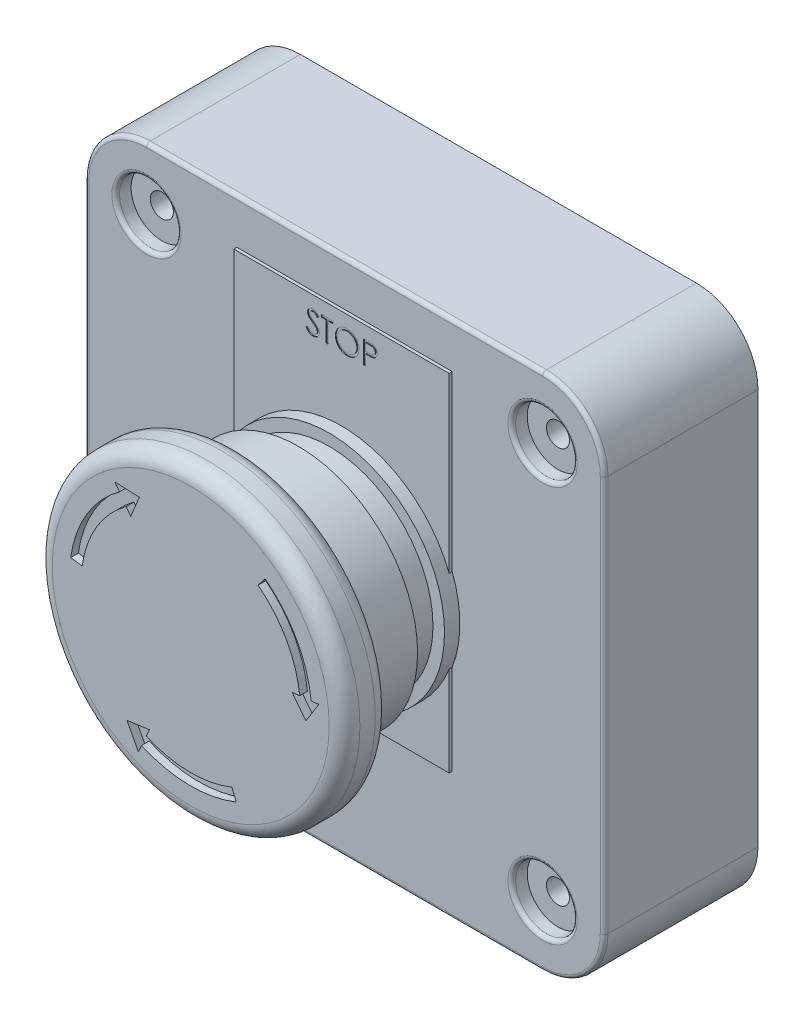
from build123d import *

# Parameters (mm, degrees)
BOSS_EXTRU_1_DEPTH      = 20
ESQUISSE2_R             = 15
ESQUISSE2_R_2           = 13.5
BOSS_EXTRU_2_DEPTH      = 2
ESQUISSE2_3_R           = 13.5
BOSS_EXTRU_3_DEPTH      = 6
BOSS_EXTRU_4_START      = 6
ESQUISSE2_4_R           = 15.5
BOSS_EXTRU_4_DEPTH      = 8
BOSS_EXTRU_5_START      = 14
ESQUISSE2_5_R           = 20
ESQUISSE2_5_R_2         = 15.5
BOSS_EXTRU_5_DEPTH      = 6
ESQUISSE3_R             = 15.5
BOSS_EXTRU_6_DEPTH      = 6
CONG_1_R                = 2
ENL_V_MAT_EXTRU_1_DEPTH = 1
ESQUISSE5_W             = 28
ESQUISSE5_H             = 45
BOSS_EXTRU_7_DEPTH      = 0.4
ESQUISSE7_R             = 1.5
ENL_V_MAT_EXTRU_4_DEPTH = 52.750603861
ESQUISSE7_5_R           = 4
ESQUISSE7_5_R_2         = 1.5
ENL_V_MAT_EXTRU_5_DEPTH = 2
COQUE1_DEPTH            = 18
COQUE1_START            = 18
COQUE1_2_DEPTH          = 20
COQUE1_3_OUTLINE_R      = 3.5
COQUE1_3_DEPTH          = 16
COQUE1_START_2          = 28
COQUE1_4_OUTLINE_R      = 13.5
COQUE1_4_DEPTH          = 9
COQUE1_START_3          = 36
COQUE1_5_DEPTH          = 2
COQUE1_6_OUTLINE_R      = 13
COQUE1_6_DEPTH          = 2
COQUE1_7_DEPTH          = 1
COQUE1_8_DEPTH          = 0.4
COQUE1_START_4          = 20
COQUE1_9_DEPTH          = 8
CONG_2_R                = 0.5
ENL_V_MAT_EXTRU_6_DEPTH = 0.1


# Read off the part's stored shape, not the designer's step: Coque1
with BuildPart() as part:
    # Esquisse1 → Boss.-Extru.1 (new body)
    with BuildSketch(Plane.XY):
        with BuildLine():
            Line((25.75, -33.75), (-25.75, -33.75))
            ThreePointArc((-25.75, -33.75), (-31.406854249, -31.406854249), (-33.75, -25.75))
            Line((-33.75, -25.75), (-33.75, 25.75))
            ThreePointArc((-33.75, 25.75), (-31.406854249, 31.406854249), (-25.75, 33.75))
            Line((-25.75, 33.75), (25.75, 33.75))
            ThreePointArc((25.75, 33.75), (31.406854249, 31.406854249), (33.75, 25.75))
            Line((33.75, 25.75), (33.75, -25.75))
            ThreePointArc((33.75, -25.75), (31.406854249, -31.406854249), (25.75, -33.75))
        make_face()
    extrude(amount=BOSS_EXTRU_1_DEPTH)

    # Esquisse2 → Boss.-Extru.2 (add)
    with BuildSketch(Plane.XY.offset(20)):
        with Locations(Location((0, 0, 0), (0, 0, 180))):
            Circle(ESQUISSE2_R)
        Circle(ESQUISSE2_R_2, mode=Mode.SUBTRACT)
    extrude(amount=BOSS_EXTRU_2_DEPTH)

    # Esquisse2<3> → Boss.-Extru.3 (add)
    with BuildSketch(Plane.XY.offset(20)):
        Circle(ESQUISSE2_3_R)
    extrude(amount=BOSS_EXTRU_3_DEPTH)

    # Esquisse2<4> → Boss.-Extru.4 (add)
    with BuildSketch(Plane.XY.offset(20).offset(BOSS_EXTRU_4_START)):
        Circle(ESQUISSE2_4_R)
    extrude(amount=BOSS_EXTRU_4_DEPTH)



with BuildPart() as body_2:
    # Esquisse2<5> → Boss.-Extru.5 (new body)
    with BuildSketch(Plane.XY.offset(20).offset(BOSS_EXTRU_5_START)):
        Circle(ESQUISSE2_5_R)
        Circle(ESQUISSE2_5_R_2, mode=Mode.SUBTRACT)
    extrude(amount=BOSS_EXTRU_5_DEPTH)


with BuildPart() as part_1:
    add(part.part)

    add(body_2.part)  # Boss.-Extru.6 merges body 2
    # Esquisse3 → Boss.-Extru.6 (add)
    with BuildSketch(Plane.XY.offset(34)):
        Circle(ESQUISSE3_R)
    extrude(amount=BOSS_EXTRU_6_DEPTH)

    # Congé1
    cong_1_edges = [part_1.edges().sort_by_distance(p)[0] for p in [
        (-20, 0, 40),
        (-20, 0, 34),
    ]]
    fillet(cong_1_edges, radius=CONG_1_R)

    # Esquisse4 → Enlèv. mat.-Extru.1 (cut)
    with BuildSketch(Plane.XY.offset(40)):
        with BuildLine():
            Line((-8.382608806, 11.523643938), (-7.794355556, 10.71496717))
            Line((-7.794355556, 10.71496717), (-6.678690973, 13.431123813))
            Line((-6.678690973, 13.431123813), (-9.85324193, 13.545335857))
            Line((-9.85324193, 13.545335857), (-9.26498868, 12.736659089))
            ThreePointArc((-9.26498868, 12.736659089), (-13.507536692, 8.09993534), (-15.599310735, 2.173477534))
            Line((-15.599310735, 2.173477534), (-14.113662094, 1.966479674))
            ThreePointArc((-14.113662094, 1.966479674), (-12.221104626, 7.328512926), (-8.382608806, 11.523643938))
        make_face()
        with BuildLine():
            Line((14.171072797, 1.497730207), (13.176611548, 1.392626333))
            Line((13.176611548, 1.392626333), (14.97103991, -0.93164586))
            Line((14.97103991, -0.93164586), (16.65722592, 1.760489892))
            Line((16.65722592, 1.760489892), (15.662764671, 1.655386018))
            ThreePointArc((15.662764671, 1.655386018), (13.768518119, 7.647902248), (9.681942127, 12.422660611))
            Line((9.681942127, 12.422660611), (8.7598524, 11.239550077))
            ThreePointArc((8.7598524, 11.239550077), (12.457230679, 6.919530606), (14.171072797, 1.497730207))
        make_face()
        with BuildLine():
            Line((-5.788463991, -13.021374145), (-5.382255992, -12.107593503))
            Line((-5.382255992, -12.107593503), (-8.292348937, -12.499477953))
            Line((-8.292348937, -12.499477953), (-6.80398399, -15.305825749))
            Line((-6.80398399, -15.305825749), (-6.397775991, -14.392045107))
            ThreePointArc((-6.397775991, -14.392045107), (-0.260981427, -15.747837588), (5.917368608, -14.596138145))
            Line((5.917368608, -14.596138145), (5.353809693, -13.20602975))
            ThreePointArc((5.353809693, -13.20602975), (-0.236126053, -14.248043532), (-5.788463991, -13.021374145))
        make_face()
    extrude(amount=-ENL_V_MAT_EXTRU_1_DEPTH, mode=Mode.SUBTRACT)

    # Esquisse5 → Boss.-Extru.7 (add)
    with BuildSketch(Plane.XY.offset(20)):
        with Locations((0, 5.407916809)):
            Rectangle(ESQUISSE5_W, ESQUISSE5_H)
    extrude(amount=BOSS_EXTRU_7_DEPTH)

    # Esquisse7 → Enlèv. mat.-Extru.4 (cut, through all)
    with BuildSketch(Plane.XY.offset(20)):
        with Locations((-25.75, 25.75)):
            Circle(ESQUISSE7_R)
        with Locations((25.75, 25.75)):
            Circle(ESQUISSE7_R)
        with Locations((25.75, -25.75)):
            Circle(ESQUISSE7_R)
        with Locations((-25.75, -25.75)):
            Circle(ESQUISSE7_R)
    extrude(amount=-ENL_V_MAT_EXTRU_4_DEPTH, mode=Mode.SUBTRACT)

    # Esquisse7<5> → Enlèv. mat.-Extru.5 (cut)
    # profile 1 of 4: a face of its own
    with BuildSketch(Plane.XY.offset(20)):
        with Locations((-25.75, 25.75)):
            Circle(ESQUISSE7_5_R)
        with Locations((-25.75, 25.75)):
            Circle(ESQUISSE7_5_R_2, mode=Mode.SUBTRACT)
    # profile 2 of 4: a face of its own
    with BuildSketch(Plane.XY.offset(20)):
        with Locations((25.75, 25.75)):
            Circle(ESQUISSE7_5_R)
        with Locations((25.75, 25.75)):
            Circle(ESQUISSE7_5_R_2, mode=Mode.SUBTRACT)
    # profile 3 of 4: a face of its own
    with BuildSketch(Plane.XY.offset(20)):
        with Locations((25.75, -25.75)):
            Circle(ESQUISSE7_5_R)
        with Locations((25.75, -25.75)):
            Circle(ESQUISSE7_5_R_2, mode=Mode.SUBTRACT)
    # profile 4 of 4: a face of its own
    with BuildSketch(Plane.XY.offset(20)):
        with Locations((-25.75, -25.75)):
            Circle(ESQUISSE7_5_R)
        with Locations((-25.75, -25.75)):
            Circle(ESQUISSE7_5_R_2, mode=Mode.SUBTRACT)
    extrude(amount=-ENL_V_MAT_EXTRU_5_DEPTH, mode=Mode.SUBTRACT)

    # Coque1 outline → Coque1 (cut)
    with BuildSketch(Plane.XY):
        with BuildLine():
            ThreePointArc((25.75, -31.75), (21.507359313, -21.507359313), (31.75, -25.75))
            Line((31.75, -25.75), (31.75, 25.75))
            ThreePointArc((31.75, 25.75), (21.507359313, 21.507359313), (25.75, 31.75))
            Line((25.75, 31.75), (-25.75, 31.75))
            ThreePointArc((-25.75, 31.75), (-21.507359313, 21.507359313), (-31.75, 25.75))
            Line((-31.75, 25.75), (-31.75, -25.75))
            ThreePointArc((-31.75, -25.75), (-21.507359313, -21.507359313), (-25.75, -31.75))
            Line((-25.75, -31.75), (25.75, -31.75))
        make_face()
    extrude(amount=COQUE1_DEPTH, mode=Mode.SUBTRACT)

    # Coque1 2 outline → Coque1 2 (cut)
    with BuildSketch(Plane.XY.offset(COQUE1_START)):
        with BuildLine():
            ThreePointArc((-2.772643429, -11.160754832), (7.200148327, -8.967043218), (11.496177304, 0.296491804))
            Line((11.496177304, 0.296491804), (9.404991287, 3.005145775))
            Line((9.404991287, 3.005145775), (11.051818924, 3.17919777))
            ThreePointArc((11.051818924, 3.17919777), (4.16561306, 10.719032971), (-6.004858086, 9.80773569))
            Line((-6.004858086, 9.80773569), (-7.305028227, 6.64238849))
            Line((-7.305028227, 6.64238849), (-8.279175495, 7.981557061))
            ThreePointArc((-8.279175495, 7.981557061), (-11.365761387, -1.751989754), (-5.491319217, -10.104227494))
            Line((-5.491319217, -10.104227494), (-2.09996306, -9.647534265))
            Line((-2.09996306, -9.647534265), (-2.772643429, -11.160754832))
        make_face()
    extrude(amount=COQUE1_2_DEPTH, mode=Mode.SUBTRACT)

    # Coque1 3 outline → Coque1 3 (cut)
    # profile 1 of 4: a face of its own
    with BuildSketch(Plane.XY):
        with BuildLine():
            ThreePointArc((25.75, -31.75), (29.992640687, -29.992640687), (31.75, -25.75))
            ThreePointArc((31.75, -25.75), (21.507359313, -21.507359313), (25.75, -31.75))
        make_face()
        with Locations((25.75, -25.75)):
            Circle(COQUE1_3_OUTLINE_R, mode=Mode.SUBTRACT)
    # profile 2 of 4: a face of its own
    with BuildSketch(Plane.XY):
        with BuildLine():
            ThreePointArc((25.75, 31.75), (21.507359313, 21.507359313), (31.75, 25.75))
            ThreePointArc((31.75, 25.75), (29.992640687, 29.992640687), (25.75, 31.75))
        make_face()
        with Locations((25.75, 25.75)):
            Circle(COQUE1_3_OUTLINE_R, mode=Mode.SUBTRACT)
    # profile 3 of 4: a face of its own
    with BuildSketch(Plane.XY):
        with BuildLine():
            ThreePointArc((-31.75, -25.75), (-29.992640687, -29.992640687), (-25.75, -31.75))
            ThreePointArc((-25.75, -31.75), (-21.507359313, -21.507359313), (-31.75, -25.75))
        make_face()
        with Locations((-25.75, -25.75)):
            Circle(COQUE1_3_OUTLINE_R, mode=Mode.SUBTRACT)
    # profile 4 of 4: a face of its own
    with BuildSketch(Plane.XY):
        with BuildLine():
            ThreePointArc((-31.75, 25.75), (-21.507359313, 21.507359313), (-25.75, 31.75))
            ThreePointArc((-25.75, 31.75), (-29.992640687, 29.992640687), (-31.75, 25.75))
        make_face()
        with Locations((-25.75, 25.75)):
            Circle(COQUE1_3_OUTLINE_R, mode=Mode.SUBTRACT)
    extrude(amount=COQUE1_3_DEPTH, mode=Mode.SUBTRACT)

    # Coque1 4 outline → Coque1 4 (cut)
    with BuildSketch(Plane.XY.offset(COQUE1_START_2)):
        Circle(COQUE1_4_OUTLINE_R)
        with BuildLine():
            Line((-2.772643429, -11.160754832), (-2.09996306, -9.647534265))
            Line((-2.09996306, -9.647534265), (-5.491319217, -10.104227494))
            ThreePointArc((-5.491319217, -10.104227494), (-11.365761387, -1.751989754), (-8.279175495, 7.981557061))
            Line((-8.279175495, 7.981557061), (-7.305028227, 6.64238849))
            Line((-7.305028227, 6.64238849), (-6.004858086, 9.80773569))
            ThreePointArc((-6.004858086, 9.80773569), (4.16561306, 10.719032971), (11.051818924, 3.17919777))
            Line((11.051818924, 3.17919777), (9.404991287, 3.005145775))
            Line((9.404991287, 3.005145775), (11.496177304, 0.296491804))
            ThreePointArc((11.496177304, 0.296491804), (7.200148327, -8.967043218), (-2.772643429, -11.160754832))
        make_face(mode=Mode.SUBTRACT)
    extrude(amount=COQUE1_4_DEPTH, mode=Mode.SUBTRACT)

    # Coque1 5 outline → Coque1 5 (cut)
    with BuildSketch(Plane.XY.offset(COQUE1_START_3)):
        with BuildLine():
            Line((17.999488296, 0.135724246), (15.142226056, -4.426131793))
            Line((15.142226056, -4.426131793), (11.496177304, 0.296491804))
            ThreePointArc((11.496177304, 0.296491804), (7.200148327, -8.967043218), (-2.772643429, -11.160754832))
            Line((-2.772643429, -11.160754832), (-3.081719099, -11.856032532))
            ThreePointArc((-3.081719099, -11.856032532), (1.799463473, -12.117113155), (6.394121619, -10.448813747))
            Line((6.394121619, -10.448813747), (8.479790067, -15.593449279))
            ThreePointArc((8.479790067, -15.593449279), (1.707476517, -17.667683038), (-5.336714588, -16.928732303))
            Line((-5.336714588, -16.928732303), (-5.438908314, -17.15862105))
            ThreePointArc((-5.438908314, -17.15862105), (10.687171617, -14.483934646), (17.999488296, 0.135724246))
        make_face()
        with BuildLine():
            Line((17.329069523, 3.842635745), (17.57925588, 3.869077757))
            ThreePointArc((17.57925588, 3.869077757), (7.199869541, 16.497329438), (-9.117284793, 15.520151997))
            Line((-9.117284793, 15.520151997), (-3.737970454, 15.326618331))
            Line((-3.737970454, 15.326618331), (-6.004858086, 9.80773569))
            ThreePointArc((-6.004858086, 9.80773569), (4.16561306, 10.719032971), (11.051818924, 3.17919777))
            Line((11.051818924, 3.17919777), (11.80848491, 3.259169239))
            ThreePointArc((11.80848491, 3.259169239), (9.593996076, 7.616937658), (5.851877335, 10.76187863))
            Line((5.851877335, 10.76187863), (9.264428175, 15.140438256))
            ThreePointArc((9.264428175, 15.140438256), (14.446924079, 10.312559559), (17.329069523, 3.842635745))
        make_face()
        with BuildLine():
            Line((-8.882203503, -15.655876243), (-11.404255601, -10.900486538))
            Line((-11.404255601, -10.900486538), (-5.491319217, -10.104227494))
            ThreePointArc((-5.491319217, -10.104227494), (-11.365761387, -1.751989754), (-8.279175495, 7.981557061))
            Line((-8.279175495, 7.981557061), (-8.726765811, 8.596863293))
            ThreePointArc((-8.726765811, 8.596863293), (-11.393459549, 4.500175497), (-12.245998954, -0.313064883))
            Line((-12.245998954, -0.313064883), (-17.744218242, 0.453011023))
            ThreePointArc((-17.744218242, 0.453011023), (-16.154400596, 7.35512348), (-11.992354934, 13.086096558))
            Line((-11.992354934, 13.086096558), (-12.140347567, 13.289543294))
            ThreePointArc((-12.140347567, 13.289543294), (-17.887041159, -2.013394793), (-8.882203503, -15.655876243))
        make_face()
    extrude(amount=COQUE1_5_DEPTH, mode=Mode.SUBTRACT)

    # Coque1 6 outline → Coque1 6 (cut)
    with BuildSketch(Plane.XY.offset(COQUE1_START)):
        Circle(COQUE1_6_OUTLINE_R)
        with BuildLine():
            Line((-2.772643429, -11.160754832), (-2.09996306, -9.647534265))
            Line((-2.09996306, -9.647534265), (-5.491319217, -10.104227494))
            ThreePointArc((-5.491319217, -10.104227494), (-11.365761387, -1.751989754), (-8.279175495, 7.981557061))
            Line((-8.279175495, 7.981557061), (-7.305028227, 6.64238849))
            Line((-7.305028227, 6.64238849), (-6.004858086, 9.80773569))
            ThreePointArc((-6.004858086, 9.80773569), (4.16561306, 10.719032971), (11.051818924, 3.17919777))
            Line((11.051818924, 3.17919777), (9.404991287, 3.005145775))
            Line((9.404991287, 3.005145775), (11.496177304, 0.296491804))
            ThreePointArc((11.496177304, 0.296491804), (7.200148327, -8.967043218), (-2.772643429, -11.160754832))
        make_face(mode=Mode.SUBTRACT)
    extrude(amount=COQUE1_6_DEPTH, mode=Mode.SUBTRACT)

    # Coque1 7 outline → Coque1 7 (cut)
    with BuildSketch(Plane.XY.offset(COQUE1_START_3)):
        with BuildLine():
            Line((15.142226056, -4.426131793), (17.999488296, 0.135724246))
            ThreePointArc((17.999488296, 0.135724246), (17.887041159, 2.013394793), (17.57925588, 3.869077757))
            Line((17.57925588, 3.869077757), (17.329069523, 3.842635745))
            ThreePointArc((17.329069523, 3.842635745), (14.446924079, 10.312559559), (9.264428175, 15.140438256))
            Line((9.264428175, 15.140438256), (6.629750973, 11.759949066))
            ThreePointArc((6.629750973, 11.759949066), (12.149786908, 5.884953534), (13.337474212, -2.088487887))
            Line((13.337474212, -2.088487887), (15.142226056, -4.426131793))
        make_face()
        with BuildLine():
            ThreePointArc((-8.882203503, -15.655876243), (-7.199869541, -16.497329438), (-5.438908314, -17.15862105))
            Line((-5.438908314, -17.15862105), (-5.336714588, -16.928732303))
            ThreePointArc((-5.336714588, -16.928732303), (1.707476517, -17.667683038), (8.479790067, -15.593449279))
            Line((8.479790067, -15.593449279), (6.869539152, -11.621507296))
            ThreePointArc((6.869539152, -11.621507296), (-0.978374193, -13.46450088), (-8.477420671, -10.506347547))
            Line((-8.477420671, -10.506347547), (-11.404255601, -10.900486538))
            Line((-11.404255601, -10.900486538), (-8.882203503, -15.655876243))
        make_face()
        with BuildLine():
            Line((-3.737970454, 15.326618331), (-9.117284793, 15.520151997))
            ThreePointArc((-9.117284793, 15.520151997), (-10.687171617, 14.483934646), (-12.140347567, 13.289543294))
            Line((-12.140347567, 13.289543294), (-11.992354934, 13.086096558))
            ThreePointArc((-11.992354934, 13.086096558), (-16.154400596, 7.35512348), (-17.744218242, 0.453011023))
            Line((-17.744218242, 0.453011023), (-13.499290125, -0.13844177))
            ThreePointArc((-13.499290125, -0.13844177), (-11.171412714, 7.579547346), (-4.86005354, 12.594835433))
            Line((-4.86005354, 12.594835433), (-3.737970454, 15.326618331))
        make_face()
    extrude(amount=COQUE1_7_DEPTH, mode=Mode.SUBTRACT)

    # Coque1 8 outline → Coque1 8 (cut)
    with BuildSketch(Plane.XY.offset(COQUE1_START)):
        with BuildLine():
            Line((12, -15.092083191), (12, -5))
            ThreePointArc((12, -5), (0, -13), (-12, -5))
            Line((-12, -5), (-12, -15.092083191))
            Line((-12, -15.092083191), (12, -15.092083191))
        make_face()
        with BuildLine():
            Line((12, 25.907916809), (-12, 25.907916809))
            Line((-12, 25.907916809), (-12, 5))
            ThreePointArc((-12, 5), (0, 13), (12, 5))
            Line((12, 5), (12, 25.907916809))
        make_face()
    extrude(amount=COQUE1_8_DEPTH, mode=Mode.SUBTRACT)

    # Coque1 9 outline → Coque1 9 (cut)
    with BuildSketch(Plane.XY.offset(COQUE1_START_4)):
        with BuildLine():
            Line((9.404991287, 3.005145775), (11.496177304, 0.296491804))
            ThreePointArc((11.496177304, 0.296491804), (11.365761387, 1.751989754), (11.051818924, 3.17919777))
            Line((11.051818924, 3.17919777), (9.404991287, 3.005145775))
        make_face()
        with BuildLine():
            Line((-2.09996306, -9.647534265), (-5.491319217, -10.104227494))
            ThreePointArc((-5.491319217, -10.104227494), (-4.165613059, -10.719032971), (-2.772643429, -11.160754832))
            Line((-2.772643429, -11.160754832), (-2.09996306, -9.647534265))
        make_face()
        with BuildLine():
            Line((-7.305028227, 6.64238849), (-6.004858086, 9.80773569))
            ThreePointArc((-6.004858086, 9.80773569), (-7.200148327, 8.967043218), (-8.279175495, 7.981557061))
            Line((-8.279175495, 7.981557061), (-7.305028227, 6.64238849))
        make_face()
    extrude(amount=COQUE1_9_DEPTH, mode=Mode.SUBTRACT)

    # Congé2
    cong_2_edges = [part_1.edges().sort_by_distance(p)[0] for p in [
        (-31.406854249, 31.406854249, 20),
        (0, 33.75, 20),
        (31.406854249, 31.406854249, 20),
        (-29.75, -25.75, 20),
        (21.75, -25.75, 20),
        (21.75, 25.75, 20),
        (-29.75, 25.75, 20),
        (33.75, 0, 20),
        (31.406854249, -31.406854249, 20),
        (0, -33.75, 20),
        (-31.406854249, -31.406854249, 20),
        (-33.75, 0, 20),
    ]]
    fillet(cong_2_edges, radius=CONG_2_R)

    # Esquisse6 → Enlèv. mat.-Extru.6 (cut)
    # profile 1 of 4: a face of its own
    with BuildSketch(Plane.XY.offset(20.4)):
        with BuildLine():
            Line((-4.591423317, 23.882915057), (-4.345390497, 24.030418145))
            add(Edge.make_bspline(
                [(-4.345390497, 24.030418145), (-4.322507773, 23.992113416), (-4.278665355, 23.918723032), (-4.205529612, 23.819554292), (-4.129748257, 23.735266832), (-4.050760103, 23.666350987), (-3.969047287, 23.61209343), (-3.884076381, 23.573674074), (-3.796133725, 23.549712219), (-3.736284065, 23.54680173), (-3.706404787, 23.545348701)],
                knots=[0, 0, 0, 0, 1.272034388, 2.437168799, 3.508375237, 4.49857839, 5.41946034, 6.295179144, 7.148887113, 8, 8, 8, 8], degree=3))
            add(Edge.make_bspline(
                [(-3.706404787, 23.545348701), (-3.680887201, 23.546059402), (-3.630298527, 23.547468368), (-3.555823258, 23.56100663), (-3.483493747, 23.581805406), (-3.414800731, 23.611592217), (-3.350692056, 23.647630231), (-3.29447387, 23.691158571), (-3.245873143, 23.739892421), (-3.206117588, 23.794261212), (-3.175616392, 23.85273327), (-3.152173345, 23.91275101), (-3.139163721, 23.975257254), (-3.137203968, 24.017342264), (-3.136214983, 24.038580371)],
                knots=[0, 0, 0, 0, 1.095163259, 2.171163733, 3.241058638, 4.321873601, 5.38011039, 6.391990106, 7.366004449, 8.327778327, 9.272591725, 10.192022065, 11.087607919, 12, 12, 12, 12], degree=3))
            add(Edge.make_bspline(
                [(-3.136214983, 24.038580371), (-3.137440943, 24.062812376), (-3.139933139, 24.112072499), (-3.160997471, 24.184749473), (-3.194134018, 24.256672163), (-3.224703907, 24.301161013), (-3.240574876, 24.324258289)],
                knots=[0, 0, 0, 0, 0.938893495, 1.908633276, 2.914225137, 4, 4, 4, 4], degree=3))
            add(Edge.make_bspline(
                [(-3.240574876, 24.324258289), (-3.253605738, 24.340928178), (-3.280962402, 24.375924524), (-3.327992667, 24.42801702), (-3.383179252, 24.481750312), (-3.444633577, 24.539176207), (-3.514594246, 24.597623857), (-3.590870043, 24.659880395), (-3.675408382, 24.723578254), (-3.734697309, 24.766296989), (-3.765289419, 24.788339152)],
                knots=[0, 0, 0, 0, 0.722233717, 1.516239348, 2.393582979, 3.351407094, 4.387010283, 5.505090956, 6.712668013, 8, 8, 8, 8], degree=3))
            add(Edge.make_bspline(
                [(-3.765289419, 24.788339152), (-3.795910325, 24.810149472), (-3.854455167, 24.851849142), (-3.936328166, 24.913736478), (-4.00954133, 24.970318196), (-4.07376925, 25.022126949), (-4.128983677, 25.069169764), (-4.175619704, 25.110994895), (-4.212489325, 25.148733487), (-4.232991615, 25.173215365), (-4.242196637, 25.184207124)],
                knots=[0, 0, 0, 0, 1.452282411, 2.77665338, 3.964542531, 5.026858415, 5.96415736, 6.766646006, 7.446254459, 8, 8, 8, 8], degree=3))
            add(Edge.make_bspline(
                [(-4.242196637, 25.184207124), (-4.255062795, 25.201337867), (-4.280365822, 25.235027773), (-4.313765768, 25.287685408), (-4.342154108, 25.34158904), (-4.364408261, 25.396883517), (-4.383148201, 25.452792562), (-4.395752742, 25.510045652), (-4.40364529, 25.568385884), (-4.404453543, 25.607646158), (-4.404858146, 25.627299405)],
                knots=[0, 0, 0, 0, 1.068054152, 2.10047183, 3.106115577, 4.101338837, 5.06977816, 6.043150881, 7.020423561, 8, 8, 8, 8], degree=3))
            add(Edge.make_bspline(
                [(-4.404858146, 25.627299405), (-4.403772802, 25.658091426), (-4.401625314, 25.71901731), (-4.383463884, 25.808018542), (-4.354798031, 25.892991414), (-4.314638532, 25.973094674), (-4.262868578, 26.046242576), (-4.20295892, 26.113276529), (-4.131602583, 26.169629332), (-4.053310193, 26.218866978), (-3.967613912, 26.257405822), (-3.877814334, 26.286477542), (-3.783768733, 26.302949883), (-3.720069579, 26.305313777), (-3.68774827, 26.306513231)],
                knots=[0, 0, 0, 0, 1.005424448, 1.989358655, 2.955360095, 3.929531133, 4.905563448, 5.876582895, 6.856512386, 7.866279853, 8.892233794, 9.918561126, 10.94386622, 12, 12, 12, 12], degree=3))
            add(Edge.make_bspline(
                [(-3.68774827, 26.306513231), (-3.653451837, 26.305330311), (-3.585247177, 26.302977862), (-3.484921609, 26.282523844), (-3.388328442, 26.248679297), (-3.310625917, 26.210271228), (-3.249812544, 26.171910759), (-3.203434861, 26.136969275), (-3.156437909, 26.096743068), (-3.108442598, 26.051124993), (-3.06026218, 25.999696474), (-3.011181369, 25.942809729), (-2.961085391, 25.880812402), (-2.928858048, 25.836553695), (-2.912336778, 25.813864576)],
                knots=[0, 0, 0, 0, 1.286793592, 2.559021753, 3.825965368, 5.121522368, 5.803751409, 6.523245864, 7.299691795, 8.125521123, 9.008227632, 9.944561021, 10.946284179, 12, 12, 12, 12], degree=3))
            Line((-2.912336778, 25.813864576), (-3.148458323, 25.634878615))
            add(Edge.make_bspline(
                [(-3.148458323, 25.634878615), (-3.162715982, 25.653246413), (-3.1901729, 25.688618498), (-3.231857956, 25.738154883), (-3.271147456, 25.783404777), (-3.309856331, 25.822707982), (-3.345940201, 25.858216839), (-3.380962528, 25.888618018), (-3.414419307, 25.914209391), (-3.456592833, 25.941520375), (-3.50957715, 25.968592658), (-3.576088101, 25.991501028), (-3.645594069, 26.005267351), (-3.692933768, 26.007087515), (-3.716899078, 26.008008957)],
                knots=[0, 0, 0, 0, 1.181633172, 2.275549214, 3.290209073, 4.226197932, 5.078386478, 5.862611352, 6.581680152, 7.217281963, 8.414376989, 9.595101626, 10.782541182, 12, 12, 12, 12], degree=3))
            add(Edge.make_bspline(
                [(-3.716899078, 26.008008957), (-3.746964948, 26.007001371), (-3.804944146, 26.005058336), (-3.887259241, 25.983837253), (-3.961345083, 25.950424123), (-4.025002186, 25.903595537), (-4.078002517, 25.848113854), (-4.116341402, 25.78426858), (-4.139416985, 25.713767975), (-4.142232838, 25.664588871), (-4.143666906, 25.639542745)],
                knots=[0, 0, 0, 0, 1.14458467, 2.207223713, 3.21896685, 4.227309161, 5.202851033, 6.127160689, 7.046193047, 8, 8, 8, 8], degree=3))
            add(Edge.make_bspline(
                [(-4.143666906, 25.639542745), (-4.143340003, 25.623949997), (-4.142685661, 25.592739005), (-4.133559594, 25.546628508), (-4.121835331, 25.500634495), (-4.103256369, 25.454963752), (-4.07760703, 25.40881755), (-4.043925047, 25.36140126), (-4.001505049, 25.312296952), (-3.969010653, 25.280359392), (-3.95185459, 25.263497322)],
                knots=[0, 0, 0, 0, 0.858281714, 1.717966888, 2.583508476, 3.4729293, 4.427298488, 5.488583878, 6.674047936, 8, 8, 8, 8], degree=3))
            add(Edge.make_bspline(
                [(-3.95185459, 25.263497322), (-3.945483794, 25.257812009), (-3.930348241, 25.244305008), (-3.902677724, 25.222192261), (-3.866137195, 25.194915193), (-3.821680829, 25.161164907), (-3.768488922, 25.122014429), (-3.706555624, 25.077964348), (-3.636571302, 25.027584654), (-3.586909685, 24.992362342), (-3.560650747, 24.973738291)],
                knots=[0, 0, 0, 0, 0.420754252, 0.999615792, 1.744751191, 2.668019286, 3.750313428, 4.999500688, 6.413464383, 8, 8, 8, 8], degree=3))
            add(Edge.make_bspline(
                [(-3.560650747, 24.973738291), (-3.529063651, 24.950753184), (-3.467899618, 24.906245711), (-3.380871857, 24.839376243), (-3.301963137, 24.773976879), (-3.230896413, 24.710465261), (-3.166969603, 24.649323151), (-3.110891927, 24.589814958), (-3.062091989, 24.532367015), (-3.009555461, 24.458714701), (-2.95587256, 24.368258049), (-2.909770306, 24.257430847), (-2.880700775, 24.146172835), (-2.876899343, 24.071394388), (-2.875023744, 24.034499258)],
                knots=[0, 0, 0, 0, 1.163667725, 2.253281268, 3.268753668, 4.215851969, 5.092017293, 5.902905408, 6.650798638, 7.335211899, 8.59617414, 9.77448103, 10.901945474, 12, 12, 12, 12], degree=3))
            add(Edge.make_bspline(
                [(-2.875023744, 24.034499258), (-2.875570186, 24.008406654), (-2.876652457, 23.956728145), (-2.88909317, 23.880845203), (-2.907320415, 23.807144414), (-2.934792448, 23.736536781), (-2.968323074, 23.66773057), (-3.010870246, 23.602530668), (-3.06018741, 23.539494037), (-3.116760725, 23.480301575), (-3.178666038, 23.425963101), (-3.244095277, 23.377626018), (-3.313155534, 23.337322299), (-3.385472167, 23.304433891), (-3.461061789, 23.278711198), (-3.539898976, 23.26007383), (-3.622113683, 23.248635301), (-3.677994083, 23.24744805), (-3.706404787, 23.246844427)],
                knots=[0, 0, 0, 0, 0.983748083, 1.948392443, 2.894712957, 3.844097841, 4.80183111, 5.778335162, 6.776009319, 7.81870978, 8.863265674, 9.881300176, 10.883814829, 11.87499822, 12.874611388, 13.892143829, 14.928324115, 16, 16, 16, 16], degree=3))
            add(Edge.make_bspline(
                [(-3.706404787, 23.246844427), (-3.728387034, 23.247269499), (-3.772074683, 23.248114289), (-3.836693817, 23.255582652), (-3.900007512, 23.266149214), (-3.961221292, 23.282924913), (-4.021123831, 23.303278685), (-4.079454596, 23.328340144), (-4.13624186, 23.358373317), (-4.191803862, 23.392712096), (-4.245999291, 23.432674399), (-4.298319825, 23.479219027), (-4.35048213, 23.531062283), (-4.40094659, 23.58961202), (-4.45073396, 23.653922318), (-4.498862614, 23.724594871), (-4.546328781, 23.801244731), (-4.576111048, 23.855183138), (-4.591423317, 23.882915057)],
                knots=[0, 0, 0, 0, 0.915332311, 1.819136955, 2.706846663, 3.586547465, 4.459518054, 5.340707479, 6.227863349, 7.133153174, 8.059268498, 9.028702269, 10.047606654, 11.120612155, 12.245963614, 13.433783089, 14.680604001, 16, 16, 16, 16], degree=3))
        make_face()
    # profile 2 of 4: a face of its own
    with BuildSketch(Plane.XY.offset(20.4)):
        Polygon((-2.613832505, 25.933382889), (-2.613832505, 26.231887162), (-1.083998103, 26.231887162), (-1.083998103, 25.933382889), (-1.718319684, 25.933382889), (-1.718319684, 23.321470496), (-1.979510923, 23.321470496), (-1.979510923, 25.933382889), align=None)
    # profile 3 of 4: a face of its own
    with BuildSketch(Plane.XY.offset(20.4)):
        with BuildLine():
            add(Edge.make_bspline(
                [(0.725684055, 26.306513231), (0.779575081, 26.305148262), (0.885421503, 26.302467352), (1.040983189, 26.281945502), (1.189493515, 26.246442253), (1.332162255, 26.199157975), (1.467282903, 26.136081441), (1.595872506, 26.059840874), (1.717625109, 25.969637533), (1.830899674, 25.866168706), (1.934557865, 25.753590917), (2.025883319, 25.633450655), (2.102420869, 25.50647433), (2.16527405, 25.373043508), (2.214583668, 25.233459951), (2.248609801, 25.08697951), (2.270344918, 24.934551268), (2.272885942, 24.830585476), (2.274174974, 24.777844861)],
                knots=[0, 0, 0, 0, 1.065120563, 2.091984664, 3.0946048, 4.079830382, 5.057816894, 6.036188127, 7.030412546, 8.04752943, 9.064399622, 10.05169764, 11.02544977, 11.989514704, 12.962713494, 13.945757189, 14.957906945, 16, 16, 16, 16], degree=3))
            add(Edge.make_bspline(
                [(2.274174974, 24.777844861), (2.272886131, 24.725492747), (2.270345673, 24.622300664), (2.248585088, 24.470839716), (2.214457543, 24.325243465), (2.165731957, 24.185754966), (2.103178389, 24.052227076), (2.026131202, 23.925011138), (1.935375088, 23.804065449), (1.832091177, 23.690714977), (1.719498763, 23.586773628), (1.598732881, 23.496202396), (1.472509507, 23.418266323), (1.339204351, 23.356080137), (1.200585332, 23.306376939), (1.055411817, 23.272489187), (0.904364057, 23.250630258), (0.801359419, 23.248120219), (0.749004702, 23.246844427)],
                knots=[0, 0, 0, 0, 1.043624062, 2.057103931, 3.04512605, 4.022047818, 4.998200453, 5.980619268, 6.982898556, 8.009068085, 9.034988726, 10.034168286, 11.015286542, 11.987931943, 12.962482838, 13.94673481, 14.956375938, 16, 16, 16, 16], degree=3))
            add(Edge.make_bspline(
                [(0.749004702, 23.246844427), (0.69626436, 23.248132816), (0.592299108, 23.250672574), (0.439679323, 23.272443659), (0.293095985, 23.306488302), (0.152968277, 23.355141685), (0.019218059, 23.418021013), (-0.108416254, 23.494693345), (-0.229422354, 23.585670593), (-0.342797009, 23.688921012), (-0.446531907, 23.801322594), (-0.536970507, 23.921759174), (-0.613660081, 24.047867908), (-0.67632828, 24.179998766), (-0.72594212, 24.317512995), (-0.759790114, 24.46132789), (-0.781689712, 24.610623539), (-0.784213332, 24.71227433), (-0.785493829, 24.763852474)],
                knots=[0, 0, 0, 0, 1.053102029, 2.075944431, 3.073151272, 4.055350789, 5.033113405, 6.020478099, 7.024410459, 8.052272461, 9.079885166, 10.07527673, 11.055994387, 12.023226415, 12.992069828, 13.970394897, 14.97016774, 16, 16, 16, 16], degree=3))
            add(Edge.make_bspline(
                [(-0.785493829, 24.763852474), (-0.785049255, 24.79847202), (-0.784165713, 24.867274373), (-0.773528812, 24.969443802), (-0.758093873, 25.069970141), (-0.735973116, 25.16856753), (-0.707042189, 25.264994611), (-0.672905473, 25.359916406), (-0.631211804, 25.452370967), (-0.584079146, 25.542796275), (-0.53147394, 25.62978273), (-0.473368927, 25.712005812), (-0.411804993, 25.790155486), (-0.344313766, 25.862206596), (-0.273119615, 25.930255178), (-0.197067618, 25.993255485), (-0.116621835, 26.051775608), (-0.031436118, 26.104512641), (0.056390507, 26.152209493), (0.146926732, 26.193139806), (0.238942941, 26.228269418), (0.332870109, 26.256742295), (0.428458813, 26.27922072), (0.525917678, 26.294527311), (0.625169062, 26.305191342), (0.692034902, 26.306070705), (0.725684055, 26.306513231)],
                knots=[0, 0, 0, 0, 1.037015668, 2.060948919, 3.074880161, 4.083647147, 5.086022904, 6.090072063, 7.104153813, 8.122640571, 9.144368836, 10.147691507, 11.138137339, 12.123020368, 13.103399296, 14.087645067, 15.080126199, 16.082011238, 17.087798457, 18.072939717, 19.057185487, 20.037253025, 21.01195951, 21.997135196, 22.992090687, 24, 24, 24, 24], degree=3))
        make_face()
        with BuildLine():
            add(Edge.make_bspline(
                [(0.738510411, 26.008008957), (0.710890861, 26.007672272), (0.655915807, 26.007002119), (0.574187535, 25.998174646), (0.493534123, 25.985593423), (0.413938916, 25.967647361), (0.335734948, 25.943196491), (0.258193264, 25.915056164), (0.182020963, 25.880778865), (0.107469511, 25.842051443), (0.035195487, 25.799186061), (-0.03300198, 25.751811324), (-0.09729944, 25.701038228), (-0.157539466, 25.646748282), (-0.213545173, 25.588665012), (-0.26641888, 25.527668969), (-0.314041264, 25.462016712), (-0.357685521, 25.393488534), (-0.396741516, 25.322173695), (-0.431471398, 25.248822995), (-0.459880398, 25.172838097), (-0.483049291, 25.09504336), (-0.502257883, 25.015561993), (-0.514426688, 24.933791052), (-0.523351156, 24.850141426), (-0.523983004, 24.793611277), (-0.52430259, 24.765018506)],
                knots=[0, 0, 0, 0, 1.008559885, 2.007477868, 2.99961109, 3.989939068, 4.984837346, 5.991145699, 7.001802488, 8.033829008, 9.059044045, 10.069351652, 11.065060232, 12.050310815, 13.029377138, 14.011219647, 14.996725999, 15.989392538, 16.977580475, 17.965360261, 18.951710183, 19.937753436, 20.929683414, 21.935841486, 22.955955122, 24, 24, 24, 24], degree=3))
            add(Edge.make_bspline(
                [(-0.52430259, 24.765018506), (-0.523242482, 24.722973612), (-0.52115692, 24.640258297), (-0.502898155, 24.519045144), (-0.474773573, 24.402555063), (-0.433314799, 24.291425452), (-0.381467294, 24.184701069), (-0.317415766, 24.083328675), (-0.241529491, 23.987280872), (-0.155328332, 23.897228199), (-0.061095105, 23.815033205), (0.03896729, 23.7428853), (0.143786867, 23.681841181), (0.253636971, 23.632110416), (0.367931144, 23.592703592), (0.48740587, 23.565696064), (0.61126527, 23.547921355), (0.695692844, 23.54621439), (0.738510411, 23.545348701)],
                knots=[0, 0, 0, 0, 1.032063989, 2.030389145, 3.003944642, 3.970395727, 4.937377036, 5.913328081, 6.909231446, 7.93887556, 8.970685674, 9.976071282, 10.964166581, 11.944589148, 12.933237628, 13.927779006, 14.949070134, 16, 16, 16, 16], degree=3))
            add(Edge.make_bspline(
                [(0.738510411, 23.545348701), (0.767289859, 23.545744105), (0.82436815, 23.546528311), (0.909265438, 23.554426913), (0.992633252, 23.567092938), (1.074354659, 23.585329323), (1.15433691, 23.608152982), (1.232913838, 23.63526786), (1.309248488, 23.669096218), (1.384303841, 23.70647258), (1.45614643, 23.749081211), (1.524728763, 23.794848054), (1.588322182, 23.845546365), (1.648517142, 23.899029689), (1.704752786, 23.956376413), (1.756648828, 24.017511978), (1.804030521, 24.082822274), (1.847658205, 24.151246508), (1.886577346, 24.222756487), (1.920487109, 24.29637313), (1.949255427, 24.371915164), (1.972479308, 24.449491548), (1.990678112, 24.528954945), (2.003217784, 24.610411751), (2.011989313, 24.693699014), (2.012650457, 24.750031256), (2.012983735, 24.778427877)],
                knots=[0, 0, 0, 0, 1.047197238, 2.076906641, 3.100256066, 4.114471768, 5.12198147, 6.126382909, 7.136867548, 8.15857795, 9.17633901, 10.174870724, 11.156907918, 12.133735059, 13.104061851, 14.077631395, 15.04955518, 16.038496417, 17.029181396, 18.010275684, 18.986308667, 19.968651475, 20.955262928, 21.950658345, 22.966943676, 24, 24, 24, 24], degree=3))
            add(Edge.make_bspline(
                [(2.012983735, 24.778427877), (2.01265019, 24.806630234), (2.011988543, 24.862574804), (2.003221973, 24.945281211), (1.990664864, 25.026151887), (1.972568136, 25.104869347), (1.949243097, 25.181453657), (1.920482085, 25.255832887), (1.886567166, 25.32828413), (1.847643899, 25.398628316), (1.803891336, 25.466128976), (1.756082135, 25.530659077), (1.703390831, 25.591006768), (1.64732288, 25.648661867), (1.586477805, 25.70239472), (1.521131222, 25.752223149), (1.45207645, 25.799349675), (1.378960766, 25.841863015), (1.303502848, 25.881123897), (1.226074158, 25.914760833), (1.147551865, 25.943342887), (1.068135647, 25.967721339), (0.987157064, 25.985523136), (0.905163285, 25.998185984), (0.82226775, 26.006999047), (0.766518121, 26.007671252), (0.738510411, 26.008008957)],
                knots=[0, 0, 0, 0, 1.02996197, 2.043119294, 3.035359645, 4.018872909, 4.991431989, 5.957985074, 6.929999688, 7.912076566, 8.892894881, 9.867085534, 10.843653904, 11.817741046, 12.803660682, 13.806313499, 14.818574707, 15.856120519, 16.894564902, 17.924820532, 18.937903209, 19.946497019, 20.957711757, 21.963978472, 22.977135795, 24, 24, 24, 24], degree=3))
        make_face(mode=Mode.SUBTRACT)
    # profile 4 of 4: a face of its own
    with BuildSketch(Plane.XY.offset(20.4)):
        with BuildLine():
            Line((2.871183521, 26.231887162), (3.441956341, 26.231887162))
            add(Edge.make_bspline(
                [(3.441956341, 26.231887162), (3.481214457, 26.231844008), (3.556434752, 26.231761323), (3.664298998, 26.229254418), (3.7622634, 26.225906032), (3.850116723, 26.221264422), (3.928129276, 26.215779043), (3.995948054, 26.208085532), (4.054106125, 26.200052536), (4.088953334, 26.191885569), (4.104845714, 26.18816095)],
                knots=[0, 0, 0, 0, 1.415646017, 2.712440637, 3.8905458, 4.950247383, 5.884950622, 6.709939814, 7.411656543, 8, 8, 8, 8], degree=3))
            add(Edge.make_bspline(
                [(4.104845714, 26.18816095), (4.124963789, 26.182654484), (4.164725883, 26.171771304), (4.222020381, 26.149973344), (4.276531525, 26.124127044), (4.328446339, 26.094670351), (4.377126869, 26.060339438), (4.423299416, 26.02252596), (4.466556507, 25.980356876), (4.50665489, 25.934305153), (4.543479808, 25.885143884), (4.575186455, 25.832139184), (4.601735465, 25.776183261), (4.624505959, 25.717315035), (4.640894477, 25.655040165), (4.653240382, 25.589791357), (4.661076577, 25.521575606), (4.6618271, 25.474959157), (4.662209162, 25.451228525)],
                knots=[0, 0, 0, 0, 0.999701418, 1.975846123, 2.934577507, 3.890451536, 4.834027766, 5.787354733, 6.749476667, 7.726910423, 8.712836071, 9.690891519, 10.682875813, 11.679750201, 12.712814741, 13.765529915, 14.8625177, 16, 16, 16, 16], degree=3))
            add(Edge.make_bspline(
                [(4.662209162, 25.451228525), (4.661858727, 25.427298433), (4.661173078, 25.380477593), (4.652943846, 25.311980697), (4.641859156, 25.246522607), (4.624814881, 25.184248463), (4.602491426, 25.125528087), (4.576304284, 25.069464122), (4.54471917, 25.017010371), (4.508426416, 24.967976405), (4.468053453, 24.922316198), (4.423771099, 24.880360634), (4.375758128, 24.8423553), (4.324167127, 24.808214995), (4.26849514, 24.77873141), (4.209586516, 24.752323699), (4.146929223, 24.730145442), (4.10357024, 24.718478778), (4.081525067, 24.712547052)],
                knots=[0, 0, 0, 0, 1.121902311, 2.195077645, 3.232258892, 4.234102512, 5.217864754, 6.176164875, 7.132989551, 8.084763148, 9.034132444, 9.988522005, 10.94243251, 11.903244335, 12.886203696, 13.894208494, 14.929344452, 16, 16, 16, 16], degree=3))
            add(Edge.make_bspline(
                [(4.081525067, 24.712547052), (4.063291445, 24.708669561), (4.023331401, 24.700171814), (3.957520459, 24.690685139), (3.880897183, 24.68258786), (3.793566156, 24.676516617), (3.695605768, 24.671319138), (3.586963026, 24.667187931), (3.467424665, 24.664917928), (3.384044351, 24.664800852), (3.340511529, 24.664739726)],
                knots=[0, 0, 0, 0, 0.601384939, 1.31797006, 2.144135048, 3.087295005, 4.142315834, 5.309527816, 6.595305764, 8, 8, 8, 8], degree=3))
            Line((3.340511529, 24.664739726), (3.13237476, 24.664739726))
            Line((3.13237476, 24.664739726), (3.13237476, 23.321470496))
            Line((3.13237476, 23.321470496), (2.871183521, 23.321470496))
            Line((2.871183521, 23.321470496), (2.871183521, 26.231887162))
        make_face()
        with BuildLine():
            Line((3.13237476, 25.933382889), (3.13237476, 24.963244))
            Line((3.13237476, 24.963244), (3.641930883, 24.956830822))
            add(Edge.make_bspline(
                [(3.641930883, 24.956830822), (3.666810726, 24.956817963), (3.714840751, 24.95679314), (3.784221943, 24.960107043), (3.848591452, 24.963932605), (3.907751554, 24.969533846), (3.961728919, 24.977451225), (4.010613548, 24.985443843), (4.05402639, 24.997006814), (4.104833286, 25.012575938), (4.161447831, 25.039129428), (4.223038525, 25.077671569), (4.275235257, 25.126799991), (4.320403507, 25.182037896), (4.356248097, 25.243488541), (4.382488407, 25.309238127), (4.397906263, 25.378612357), (4.399973651, 25.426083863), (4.401017923, 25.450062493)],
                knots=[0, 0, 0, 0, 1.160613943, 2.240541288, 3.23993089, 4.169200891, 5.011653406, 5.7853311, 6.478053781, 7.106038997, 8.262395093, 9.384106736, 10.481365981, 11.59014053, 12.70357646, 13.786202915, 14.881775077, 16, 16, 16, 16], degree=3))
            add(Edge.make_bspline(
                [(4.401017923, 25.450062493), (4.399967972, 25.473461007), (4.3978808, 25.519974356), (4.382367561, 25.5881436), (4.356299114, 25.653200313), (4.320162886, 25.713880909), (4.276306125, 25.768920051), (4.225332803, 25.81673165), (4.167362906, 25.855167197), (4.113438514, 25.879974991), (4.065540385, 25.89512186), (4.023936428, 25.905719802), (3.976961742, 25.914181303), (3.924601035, 25.921032842), (3.867260144, 25.926898131), (3.804446438, 25.930877899), (3.736397867, 25.933207443), (3.689157172, 25.933322991), (3.664668514, 25.933382889)],
                knots=[0, 0, 0, 0, 1.120700087, 2.227813068, 3.331159281, 4.466773991, 5.599788987, 6.693661531, 7.80175334, 8.91857717, 9.525282508, 10.207424825, 10.974604443, 11.810962634, 12.737642355, 13.736264703, 14.826523623, 16, 16, 16, 16], degree=3))
            Line((3.664668514, 25.933382889), (3.13237476, 25.933382889))
        make_face(mode=Mode.SUBTRACT)
    extrude(amount=-ENL_V_MAT_EXTRU_6_DEPTH, mode=Mode.SUBTRACT)


solid = part_1.part
